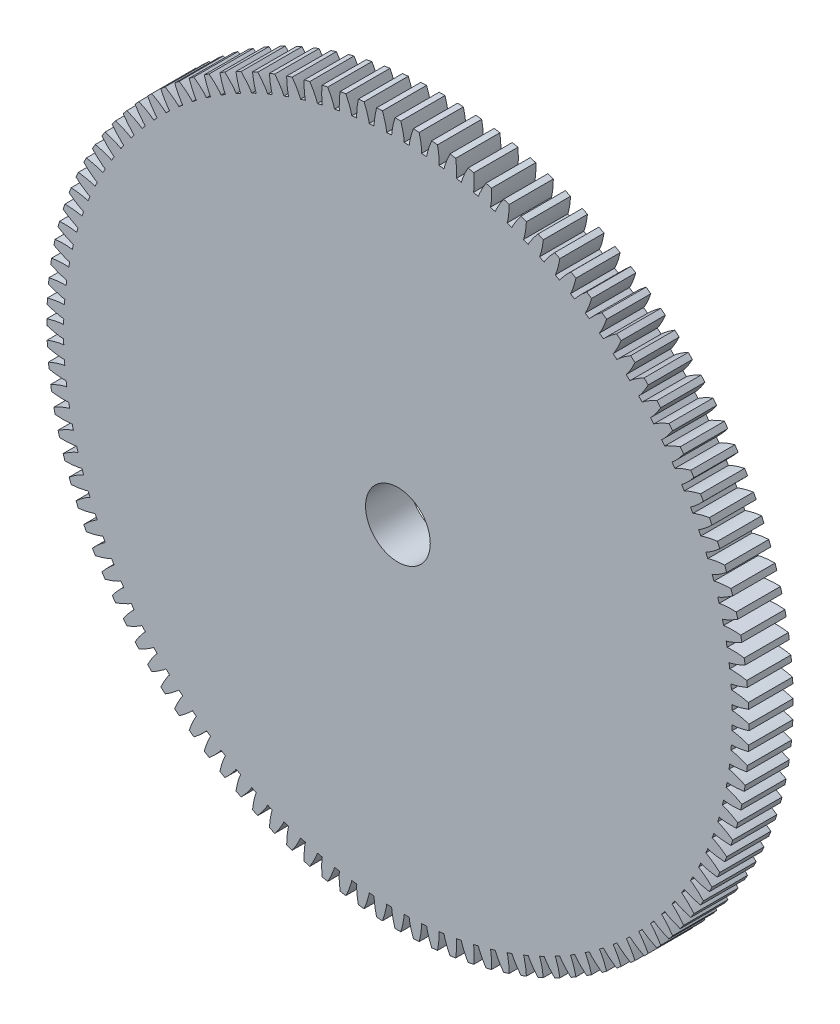
from build123d import *

# Parameters (mm, degrees)
SKETCH1_R               = 51.646666667
BOSS_EXTRUDE1_DEPTH     = 6.5
CUT_EXTRUDE2_DEPTH      = 8.5
CUT_EXTRUDE2_DEPTH_BACK = 8.5
SKETCH2_R               = 4.7625
CUT_EXTRUDE4_DEPTH      = 7.5
CIRPATTERN1_COUNT       = 120


with BuildPart() as part:
    # Sketch1 → Boss-Extrude1 (new body)
    with BuildSketch(Plane.XY):
        Circle(SKETCH1_R)
    extrude(amount=BOSS_EXTRUDE1_DEPTH)

    # Sketch2 → Cut-Extrude2 (cut, two sides: drawn at the far end of the back side and taken through both)
    with BuildSketch(Plane.XY.offset(-CUT_EXTRUDE2_DEPTH_BACK)):
        Circle(SKETCH2_R)
    extrude(amount=CUT_EXTRUDE2_DEPTH + CUT_EXTRUDE2_DEPTH_BACK, mode=Mode.SUBTRACT)

    # Sketch3 → Cut-Extrude4 (cut, symmetric)
    with BuildSketch(Plane.XY):
        with BuildLine():
            add(Edge.make_bspline(
                [(49.173360836, 0.916442482), (49.18384042, 0.916566717), (49.203665183, 0.916389865), (49.236041745, 0.915655843), (49.281069512, 0.913831713), (49.334507278, 0.910924832), (49.397549658, 0.906541371), (49.466941868, 0.900717551), (49.542570383, 0.893292773), (49.61814797, 0.884920963), (49.693667957, 0.875669666), (49.769018057, 0.865640989), (49.860443016, 0.85252946), (49.97028668, 0.83546689), (50.099019249, 0.813561678), (50.245444605, 0.786397355), (50.395173351, 0.756216682), (50.542926147, 0.724464621), (50.692735499, 0.690005779), (50.838058678, 0.654980248), (50.989598286, 0.61614374), (51.129772372, 0.579049403), (51.287526258, 0.53475208), (51.415036017, 0.498206745), (51.54737887, 0.458157207), (51.611885358, 0.438324893), (51.64489264, 0.428045811)],
                knots=[1.3e-07, 1.3e-07, 1.3e-07, 1.3e-07, 1.3e-07, 0.015083688, 0.02853182, 0.04661014, 0.06485485, 0.092110526, 0.119476176, 0.146842496, 0.174208854, 0.201574956, 0.228941013, 0.256307345, 0.307035032, 0.361767352, 0.416499661, 0.471231937, 0.525964282, 0.580696616, 0.635428982, 0.690161387, 0.744893688, 0.799626082, 0.854358407, 0.909090989, 0.909090989, 0.909090989, 0.909090989, 0.909090989], degree=4))
            add(Edge.make_bspline(
                [(51.64489264, 0.428045811), (51.729651536, 0.428748255), (51.893906687, 0.430109643), (52.306530901, 0.433529575), (52.626157698, 0.436178722), (53.078541106, 0.439928189), (53.448425948, 0.442993886), (53.867627873, 0.446468337), (54.246446373, 0.449608079), (54.654621988, 0.45299114), (55.038305363, 0.456171204), (55.432204014, 0.459435934), (55.822263272, 0.462668842), (56.205473452, 0.465844984), (56.602827488, 0.469138353), (56.995750762, 0.472394999), (57.400093172, 0.47574629), (57.791188074, 0.478987782), (58.210246004, 0.482461039), (58.578360763, 0.485512066), (59.036526598, 0.489309459), (59.34843758, 0.491894655), (59.757270843, 0.495283167), (59.9172769, 0.496609337), (59.997819258, 0.497276892)],
                knots=[0.083333333, 0.083333333, 0.083333333, 0.083333333, 0.083333333, 0.123922085, 0.164486989, 0.203919128, 0.245640644, 0.283463065, 0.324862637, 0.363448184, 0.401437538, 0.443624084, 0.479586386, 0.519793574, 0.557377518, 0.596757987, 0.637386485, 0.67814217, 0.716036134, 0.757316468, 0.797189789, 0.837516216, 0.878097019, 0.916666667, 0.916666667, 0.916666667, 0.916666667, 0.916666667], degree=4))
            add(Edge.make_bspline(
                [(59.997819258, 0.497276892), (59.997642726, 0.518575974), (59.997269865, 0.560059567), (59.996273068, 0.664565782), (59.995261818, 0.744519575), (59.993781282, 0.86011974), (59.992303561, 0.954280053), (59.990545534, 1.061376264), (59.988676117, 1.160666778), (59.986596883, 1.264627477), (59.984361083, 1.365842191), (59.981947021, 1.468566009), (59.97935042, 1.570614564), (59.976602654, 1.672659161), (59.973637258, 1.775368542), (59.970572825, 1.876561557), (59.967208328, 1.9804886), (59.963878718, 2.079740878), (59.960029353, 2.186782325), (59.956577079, 2.280890933), (59.952005541, 2.396410157), (59.948830947, 2.476307301), (59.944356945, 2.580722462), (59.942558211, 2.622168717), (59.941619794, 2.643447849)],
                knots=[0.083333333, 0.083333333, 0.083333333, 0.083333333, 0.083333333, 0.123015873, 0.162698413, 0.202380952, 0.242063492, 0.281746032, 0.321428571, 0.361111111, 0.400793651, 0.44047619, 0.48015873, 0.51984127, 0.55952381, 0.599206349, 0.638888889, 0.678571429, 0.718253968, 0.757936508, 0.797619048, 0.837301587, 0.876984127, 0.916666667, 0.916666667, 0.916666667, 0.916666667, 0.916666667], degree=4))
            add(Edge.make_bspline(
                [(59.941619794, 2.643447849), (59.858319983, 2.639774296), (59.703135353, 2.632930595), (59.312499408, 2.615703403), (59.020783244, 2.60283861), (58.606088921, 2.584550435), (58.260277324, 2.569300013), (57.859465495, 2.551624061), (57.496042248, 2.535596959), (57.099188575, 2.518095563), (56.729728777, 2.501802247), (56.36779352, 2.485840766), (56.0012911, 2.469677871), (55.634949418, 2.453522065), (55.258889689, 2.43693769), (54.870819425, 2.419823645), (54.487394379, 2.402914456), (54.08400337, 2.385124761), (53.704331692, 2.368381097), (53.295388965, 2.350346569), (52.936963291, 2.334539862), (52.521463085, 2.316216147), (52.219639536, 2.302905615), (51.83711307, 2.286036054), (51.677727668, 2.279007097), (51.596517476, 2.275425697)],
                knots=[0.083333333, 0.083333333, 0.083333333, 0.083333333, 0.083333333, 0.123260854, 0.159318546, 0.197811954, 0.233027389, 0.269069906, 0.309877622, 0.349805143, 0.383267774, 0.424652171, 0.459252987, 0.493239183, 0.530412296, 0.570339816, 0.610221809, 0.64719005, 0.685114365, 0.729048295, 0.765971008, 0.80369045, 0.838966589, 0.877740749, 0.916666667, 0.916666667, 0.916666667, 0.916666667, 0.916666667], degree=4))
            add(Edge.make_bspline(
                [(49.153933527, 1.658348376), (49.164405251, 1.658772771), (49.18419359, 1.659986928), (49.216487364, 1.662414403), (49.261357955, 1.666592604), (49.314570352, 1.672292218), (49.377296922, 1.679969055), (49.446289237, 1.689416601), (49.521425523, 1.700789294), (49.596461387, 1.713105056), (49.671393701, 1.726296086), (49.746115676, 1.740254538), (49.836729136, 1.75813291), (49.945529277, 1.78092087), (50.072938992, 1.809533404), (50.217742007, 1.844323811), (50.36568602, 1.882299318), (50.511574552, 1.921740649), (50.659375159, 1.963992682), (50.802666082, 2.006575839), (50.951965465, 2.053290093), (51.09000608, 2.097669738), (51.245225426, 2.150162554), (51.370647803, 2.19333115), (51.500713254, 2.240252091), (51.564093395, 2.263433234), (51.596517476, 2.275425697)],
                knots=[0, 0, 0, 0, 0, 0.015083688, 0.02853182, 0.04661014, 0.06485485, 0.092110526, 0.119476176, 0.146842496, 0.174208854, 0.201574956, 0.228941013, 0.256307345, 0.307035032, 0.361767352, 0.416499661, 0.471231937, 0.525964282, 0.580696616, 0.635428982, 0.690161387, 0.744893688, 0.799626082, 0.854358407, 0.909090914, 0.909090914, 0.909090914, 0.909090914, 0.909090914], degree=4))
            add(Edge.make_bspline(
                [(49.153933527, 1.658348376), (49.154108307, 1.651673792), (49.154470369, 1.637847201), (49.155394419, 1.602559154), (49.156132466, 1.574374293), (49.157191942, 1.53391451), (49.158022611, 1.502192549), (49.158936078, 1.467308675), (49.159760078, 1.435841366), (49.160615387, 1.403178438), (49.161472634, 1.370441506), (49.162329541, 1.337717544), (49.16321808, 1.303785607), (49.164140847, 1.268546544), (49.165096303, 1.232059161), (49.166073376, 1.194746248), (49.167055942, 1.157223577), (49.167961336, 1.122647945), (49.168938851, 1.085318177), (49.169802717, 1.052328445), (49.170922006, 1.009584531), (49.171686192, 0.980401459), (49.172743501, 0.940024439), (49.173154617, 0.924324558), (49.173360836, 0.916442482)],
                knots=[0.083333333, 0.083333333, 0.083333333, 0.083333333, 0.083333333, 0.119319483, 0.159812843, 0.201093178, 0.243303571, 0.280291323, 0.314751221, 0.350761218, 0.38877442, 0.424593636, 0.463226877, 0.497138278, 0.541351877, 0.583276099, 0.626201923, 0.666552198, 0.706902473, 0.743675595, 0.785599817, 0.828954899, 0.874170101, 0.916666667, 0.916666667, 0.916666667, 0.916666667, 0.916666667], degree=4))
        make_face()
    cut_extrude4 = extrude(amount=CUT_EXTRUDE4_DEPTH, both=True, mode=Mode.SUBTRACT)

    # CirPattern1: Cut-Extrude4 ×120 about axis
    cirpattern1_axis = Axis((0, 0, -0.325), (0, 0, 1))
    for i in range(1, CIRPATTERN1_COUNT):
        add(cut_extrude4.rotate(cirpattern1_axis, i * 360 / CIRPATTERN1_COUNT), mode=Mode.SUBTRACT)


solid = part.part
